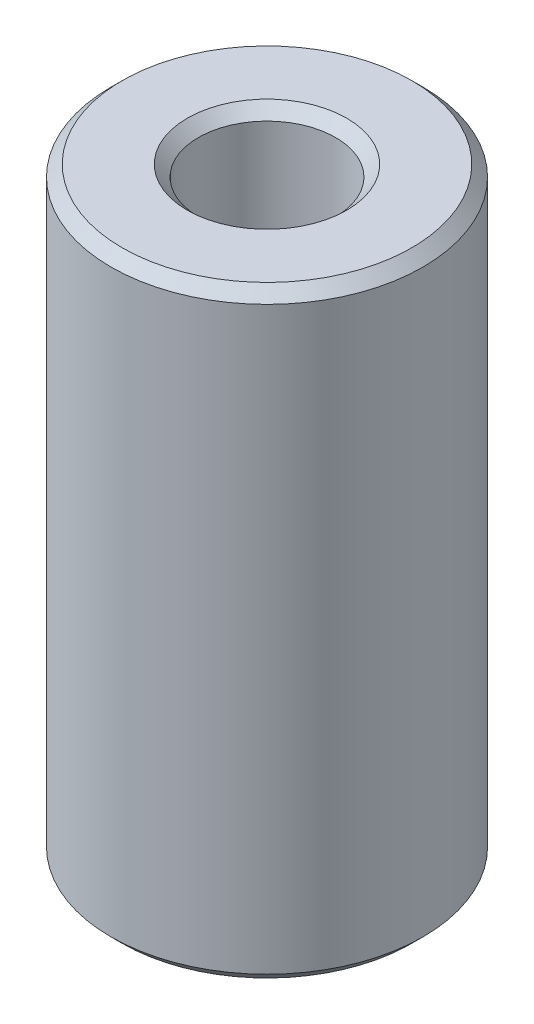
from build123d import *

# Parameters (mm, degrees)
SKETCH1_R           = 7.5
BOSS_EXTRUDE1_DEPTH = 28.971453635
SKETCH2_R           = 3.298900253
CUT_EXTRUDE1_DEPTH  = 31.851987387
CHAMFER1_SIZE       = 0.535824261


with BuildPart() as part:
    # Sketch1 → Boss-Extrude1 (new body)
    with BuildSketch(Plane(origin=(0, 0, 0), x_dir=(1, 0, 0), z_dir=(0, 1, 0))):
        Circle(SKETCH1_R)
    extrude(amount=BOSS_EXTRUDE1_DEPTH)

    # Sketch2 → Cut-Extrude1 (cut, through all)
    with BuildSketch(Plane(origin=(0, 0, 0), x_dir=(1, 0, 0), z_dir=(0, 1, 0))):
        Circle(SKETCH2_R)
    extrude(amount=CUT_EXTRUDE1_DEPTH, mode=Mode.SUBTRACT)

    # Chamfer1
    chamfer1_edges = [part.edges().sort_by_distance(p)[0] for p in [
        (-3.298900253, 28.971453635, 0),
        (-3.298900253, 0, 0),
        (-7.5, 0, 0),
        (-7.5, 28.971453635, 0),
    ]]
    chamfer(chamfer1_edges, length=CHAMFER1_SIZE)


solid = part.part
